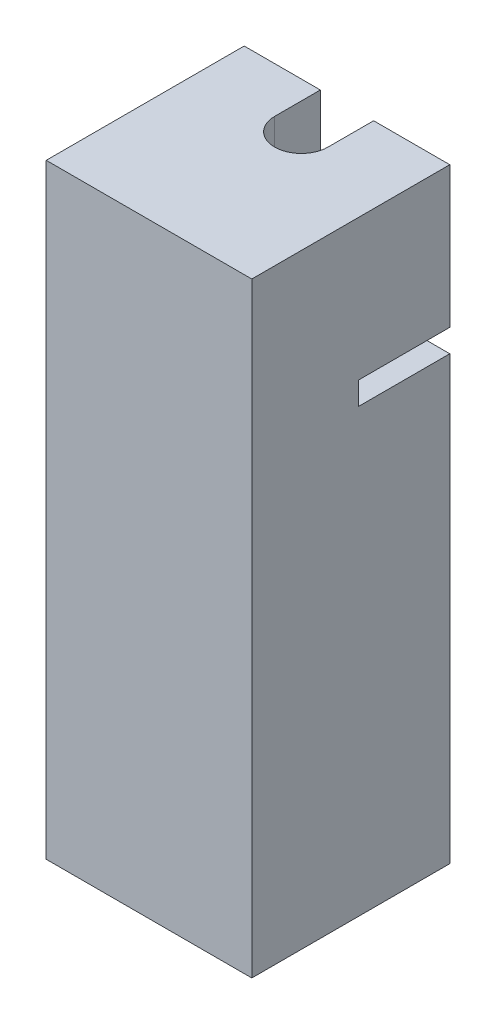
from build123d import *
from build123d.topology import SkipClean

# Parameters (mm, degrees)
BOSS_EXTRUDE1_DEPTH = 19.875
SKETCH2_W           = 13.5
SKETCH2_H           = 1.5
CUT_EXTRUDE1_DEPTH  = 6
BOSS_EXTRUDE2_REACH = 26.69
SKETCH2_3_W         = 13.5
SKETCH2_3_H         = 9.25
BOSS_EXTRUDE3_START = 3
BOSS_EXTRUDE3_DEPTH = 3


with BuildPart() as part:
    # Sketch1 → Boss-Extrude1 (new, symmetric)
    with BuildSketch(Plane(origin=(0, 0, 0), x_dir=(1, 0, 0), z_dir=(0, 1, 0))):
        with BuildLine():
            Line((-6.75, 3), (-1.75, 3))
            Line((-1.75, 3), (-1.75, 0))
            ThreePointArc((-1.75, 0), (0, -1.75), (1.75, 0))
            Line((1.75, 0), (1.75, 3))
            Line((1.75, 3), (6.75, 3))
            Line((6.75, 3), (6.75, -10))
            Line((6.75, -10), (-6.75, -10))
            Line((-6.75, -10), (-6.75, 3))
        make_face()
    extrude(amount=BOSS_EXTRUDE1_DEPTH, both=True)

    # Sketch2 → Cut-Extrude1 (cut)
    with BuildSketch(Plane(origin=(0, 0, -3), x_dir=(-1, 0, 0), z_dir=(0, 0, -1))):
        with Locations((0, 9.875)):
            Rectangle(SKETCH2_W, SKETCH2_H)
    extrude(amount=-CUT_EXTRUDE1_DEPTH, mode=Mode.SUBTRACT)

    # Sketch2<3> → Boss-Extrude2 (add, up to next)
    with BuildSketch(Plane(origin=(0, 0, -3), x_dir=(-1, 0, 0), z_dir=(0, 0, -1)), mode=Mode.PRIVATE) as boss_extrude2_sk1:
        with Locations((0, -15.25)):
            Rectangle(SKETCH2_3_W, SKETCH2_3_H)
    boss_extrude2_tool1 = extrude(boss_extrude2_sk1.sketch, amount=-BOSS_EXTRUDE2_REACH, mode=Mode.PRIVATE) - part.part
    add(boss_extrude2_tool1.solids().sort_by_distance((0, -15.25, -3))[0])

    # Sketch3 → Boss-Extrude3 (add)
    with SkipClean():  # the faces are left unmerged after this step: merging them gives an invalid solid
        with BuildSketch(Plane(origin=(0, -10.625, 0), x_dir=(1, 0, 0), z_dir=(0, 1, 0)).offset(BOSS_EXTRUDE3_START)):
            with BuildLine():
                Line((1.75, 0), (1.75, 3))
                Line((1.75, 3), (-1.75, 3))
                Line((-1.75, 3), (-1.75, 0))
                ThreePointArc((-1.75, 0), (0, 1.75), (1.75, 0))
            make_face()
        extrude(amount=-BOSS_EXTRUDE3_DEPTH)


solid = part.part
